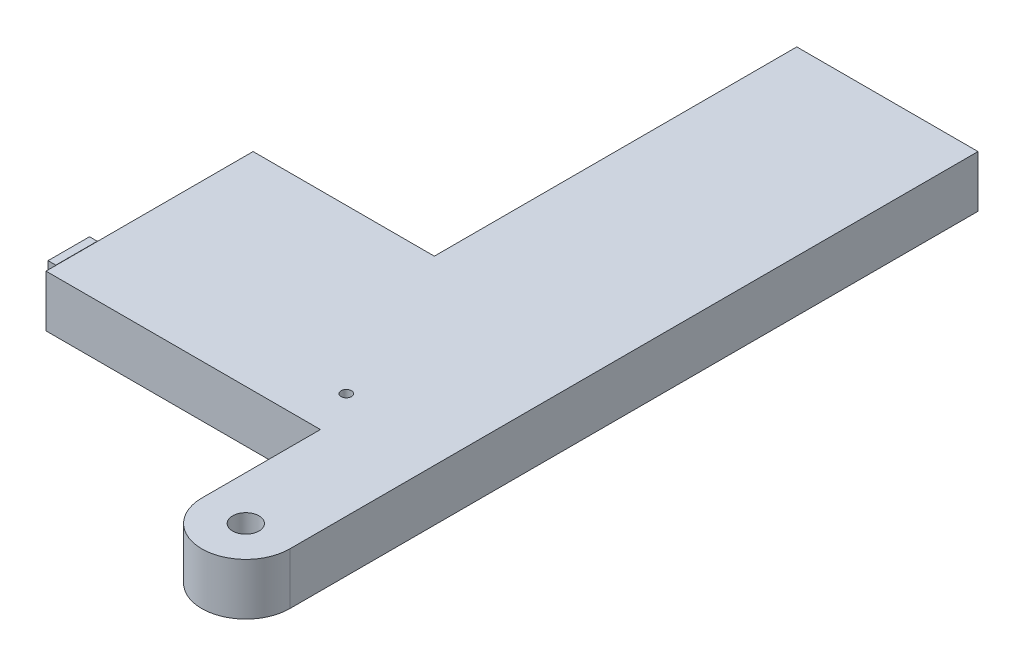
from build123d import *

# Parameters (mm, degrees)
CORNERBOSS_EXTRUDE1_DEPTH               = 20
SHELL1_T                                = -3
PADSKETCH1_R                            = 5
PADSKETCH1_R_2                          = 12
PADBOSS_EXTRUDE1_DEPTH                  = 10
STEPPERSHAFTCUT_SKETCH3_R               = 5.1
STEPPERSHAFTCUT_SKETCH3_R_2             = 2
STEPPERSHAFTCUT_EXTRUDE1_DEPTH          = 262.09193783
THREADEDNUTMOUNTHOLESSKETCH5_R          = 2
THREADEDNUTMOUNTHOLESCUT_EXTRUDE2_DEPTH = 10
TOPPEGHOLESKETCH4_W                     = 10
TOPPEGHOLESKETCH4_H                     = 14
TOPPEGHOLECUT_EXTRUDE2_DEPTH            = 3
BLPEGSKETCH5_W                          = 9.8
BLPEGSKETCH5_H                          = 13.9
BLPEGBOSS_EXTRUDE3_DEPTH                = 3.1
BLPEGCAPSKETCH6_W                       = 16
BLPEGCAPSKETCH6_H                       = 17
BLPEGCAPBOSS_EXTRUDE4_DEPTH             = 3
BEDCENTERPEGHOLECUTSKETCH1_W            = 10
BEDCENTERPEGHOLECUTSKETCH1_H            = 14
BEDCENTERPEGHOLECUT_EXTRUDE1_DEPTH      = 3


with BuildPart() as part:
    # CornerrSketch1 → CornerBoss-Extrude1 (new body)
    with BuildSketch(Plane(origin=(0, 0, 0), x_dir=(1, 0, 0), z_dir=(0, 1, 0))):
        with BuildLine():
            Line((0, 0), (0, 80))
            Line((0, 80), (70, 80))
            Line((70, 80), (70, 220))
            Line((70, 220), (140, 220))
            Line((140, 220), (140, -45.825))
            ThreePointArc((140, -45.825), (123, -62.825), (106, -45.825))
            Line((106, -45.825), (106, 0))
            Line((106, 0), (0, 0))
        make_face()
    extrude(amount=CORNERBOSS_EXTRUDE1_DEPTH)

    # Shell1
    shell1_openings = [part.faces().sort_by_distance(p)[0] for p in [
        (89.539211683, 0, -80.750143578),
    ]]
    offset(amount=SHELL1_T, openings=shell1_openings, kind=Kind.INTERSECTION)

    # PadSketch1 → PadBoss-Extrude1 (add)
    with BuildSketch(Plane.XZ.offset(-17)):
        with Locations((99, -17)):
            Circle(PADSKETCH1_R)
        with Locations((123, 45.825)):
            Circle(PADSKETCH1_R_2)
    extrude(amount=PADBOSS_EXTRUDE1_DEPTH)

    # StepperShaftCut-Sketch3 → StepperShaftCut-Extrude1 (cut, through all)
    with BuildSketch(Plane.XZ.offset(-7)):
        with Locations((123, 45.825)):
            Circle(STEPPERSHAFTCUT_SKETCH3_R)
        with Locations((99, -17)):
            Circle(STEPPERSHAFTCUT_SKETCH3_R_2)
    extrude(amount=-STEPPERSHAFTCUT_EXTRUDE1_DEPTH, mode=Mode.SUBTRACT)

    # ThreadedNutMountHolesSketch5 → ThreadedNutMountHolesCut-Extrude2 (cut)
    with BuildSketch(Plane.XZ.offset(-7)):
        with Locations((123, 53.825)):
            Circle(THREADEDNUTMOUNTHOLESSKETCH5_R)
        with Locations((131, 45.825)):
            Circle(THREADEDNUTMOUNTHOLESSKETCH5_R)
        with Locations((115, 45.825)):
            Circle(THREADEDNUTMOUNTHOLESSKETCH5_R)
        with Locations((123, 37.825)):
            Circle(THREADEDNUTMOUNTHOLESSKETCH5_R)
    extrude(amount=-THREADEDNUTMOUNTHOLESCUT_EXTRUDE2_DEPTH, mode=Mode.SUBTRACT)

    # TopPegHoleSketch4 → TopPegHoleCut-Extrude2 (cut)
    with BuildSketch(Plane(origin=(0, 0, -220), x_dir=(-1, 0, 0), z_dir=(0, 0, -1))):
        with Locations((-125, 7)):
            Rectangle(TOPPEGHOLESKETCH4_W, TOPPEGHOLESKETCH4_H)
    extrude(amount=-TOPPEGHOLECUT_EXTRUDE2_DEPTH, mode=Mode.SUBTRACT)

    # BLPegSketch5 → BLPegBoss-Extrude3 (add)
    with BuildSketch(Plane.ZY):
        with Locations((-15, 6.95)):
            Rectangle(BLPEGSKETCH5_W, BLPEGSKETCH5_H)
    extrude(amount=BLPEGBOSS_EXTRUDE3_DEPTH)

    # BLPegCapSketch6 → BLPegCapBoss-Extrude4 (add)
    with BuildSketch(Plane.ZY.offset(3.1)):
        with Locations((-14.9, 8.5)):
            Rectangle(BLPEGCAPSKETCH6_W, BLPEGCAPSKETCH6_H)
    extrude(amount=BLPEGCAPBOSS_EXTRUDE4_DEPTH)

    # BedCenterPegHoleCutSketch1 → BedCenterPegHoleCut-Extrude1 (cut)
    with BuildSketch(Plane.ZY.offset(-70)):
        with Locations((-185, 7)):
            Rectangle(BEDCENTERPEGHOLECUTSKETCH1_W, BEDCENTERPEGHOLECUTSKETCH1_H)
    extrude(amount=-BEDCENTERPEGHOLECUT_EXTRUDE1_DEPTH, mode=Mode.SUBTRACT)


solid = part.part
